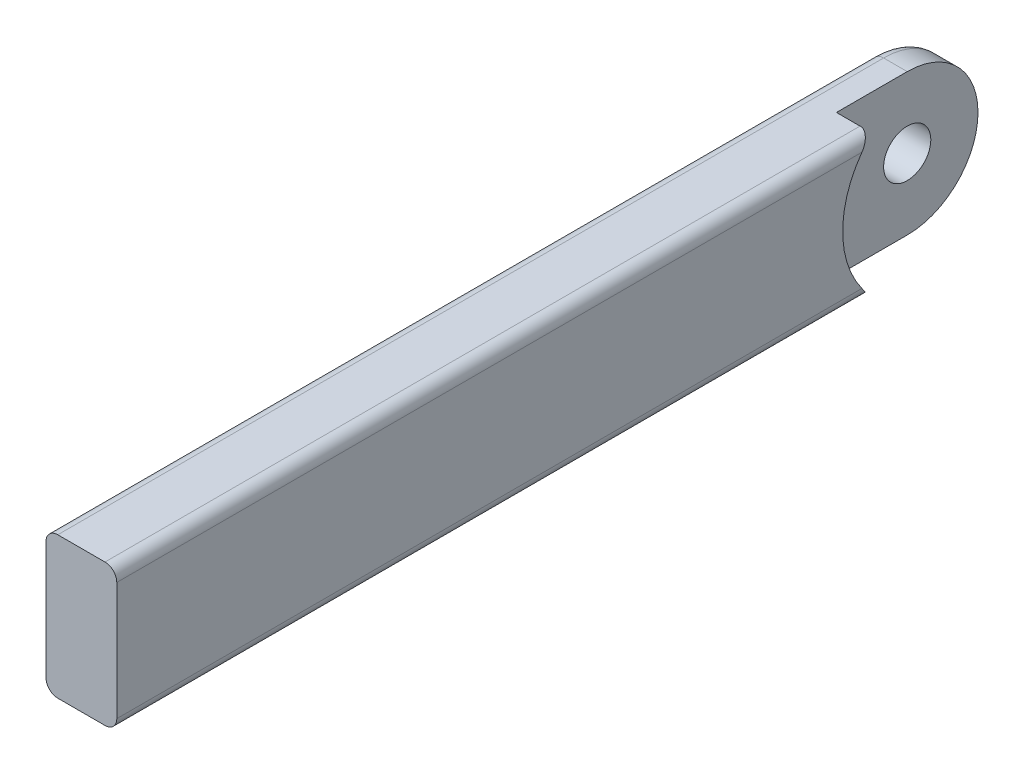
from build123d import *

# Parameters (mm, degrees)
SKETCH1_W           = 15
SKETCH1_H           = 190
BOSS_EXTRUDE1_DEPTH = 30
SKETCH2_W           = 7.5
SKETCH2_H           = 30
CUT_EXTRUDE1_DEPTH  = 30
SKETCH4_R           = 5
CUT_EXTRUDE2_DEPTH  = 30
FILLET2_R           = 15
SKETCH5_R           = 21.176084542
CUT_EXTRUDE3_DEPTH  = 30
FILLET4_R           = 2.5


with BuildPart() as part:
    # Sketch1 → Boss-Extrude1 (new body)
    with BuildSketch(Plane(origin=(0, 0, 0), x_dir=(1, 0, 0), z_dir=(0, 1, 0))):
        with Locations((-18.952702703, -65.101351351)):
            Rectangle(SKETCH1_W, SKETCH1_H)
    extrude(amount=BOSS_EXTRUDE1_DEPTH)

    # Sketch2 → Cut-Extrude1 (cut)
    with BuildSketch(Plane(origin=(0, 0, -29.898648649), x_dir=(-1, 0, 0), z_dir=(0, 0, -1))):
        with Locations((15.202702703, 15)):
            Rectangle(SKETCH2_W, SKETCH2_H)
    extrude(amount=-CUT_EXTRUDE1_DEPTH, mode=Mode.SUBTRACT)

    # Sketch4 → Cut-Extrude2 (cut)
    with BuildSketch(Plane(origin=(-18.952702703, 0, 0), x_dir=(0, 0, -1), z_dir=(1, 0, 0))):
        with Locations((14.898648649, 15)):
            Circle(SKETCH4_R)
    extrude(amount=-CUT_EXTRUDE2_DEPTH, mode=Mode.SUBTRACT)

    # Fillet2
    fillet2_edges = [part.edges().sort_by_distance(p)[0] for p in [
        (-22.702702703, 0, -29.898648649),
        (-22.702702703, 30, -29.898648649),
    ]]
    fillet(fillet2_edges, radius=FILLET2_R - 0.0001)  # a hair under: the kernel refuses the full size

    # Sketch5 → Cut-Extrude3 (cut)
    with BuildSketch(Plane(origin=(-18.952702703, 0, 0), x_dir=(0, 0, -1), z_dir=(1, 0, 0))):
        with Locations((14.898648649, 15)):
            Circle(SKETCH5_R)
    extrude(amount=CUT_EXTRUDE3_DEPTH, mode=Mode.SUBTRACT)

    # Fillet4
    fillet4_edges = [part.edges().sort_by_distance(p)[0] for p in [
        (-26.452702703, 0, 72.601301351),
        (-26.452702703, 4.393368993, -25.505279656),
        (-26.452702703, 25.606631007, -25.505279656),
        (-26.452702703, 30, 72.601301351),
        (-11.452702703, 30, 80.101351351),
        (-11.452702703, 0, 80.101351351),
    ]]
    fillet(fillet4_edges, radius=FILLET4_R)


solid = part.part
